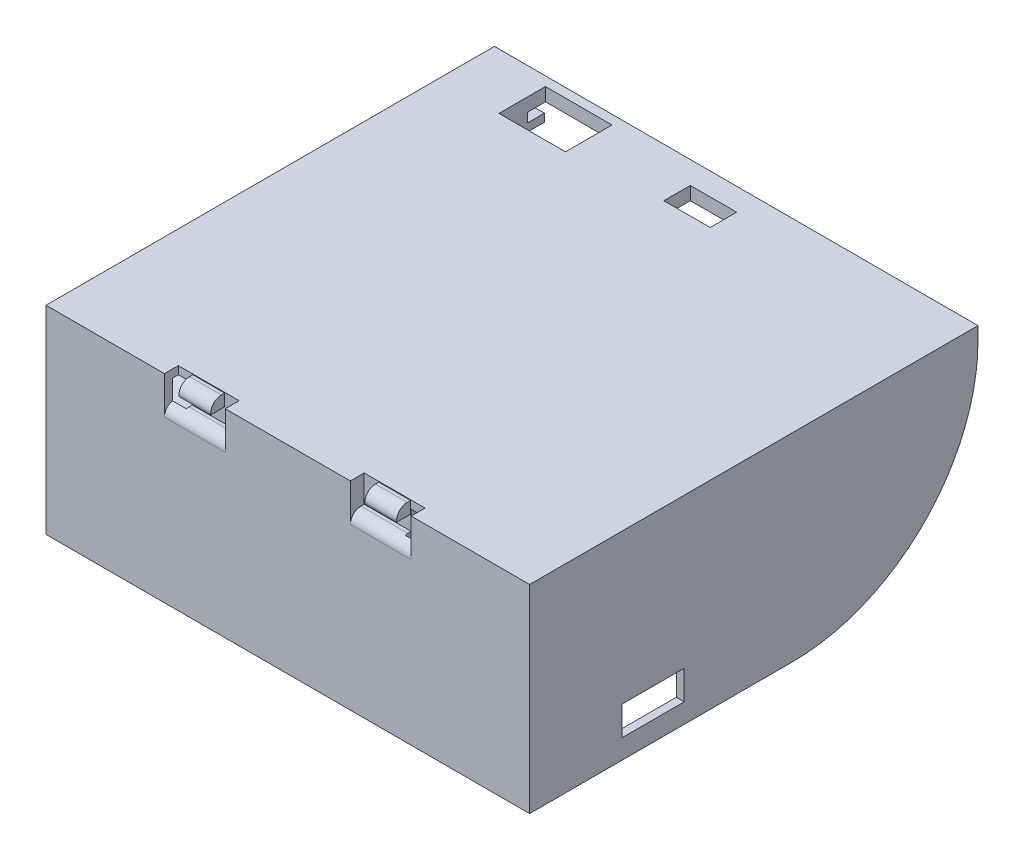
from build123d import *

# Parameters (mm, degrees)
SKETCH_3_W               = 73.1
SKETCH_3_H               = 20.7
EXTRUDE_2_DEPTH          = 13
SKETCH_4_W               = 73.1
SKETCH_4_H               = 20.7
EXTRUDE_3_DEPTH          = 1.2
EXTRUDE_START            = -4.2
SKETCH_2_R               = 9
EXTRUDE_1_DEPTH          = 65
EXTRUDE_START_2          = -20
EXTRUDE_4_DEPTH          = 5
EXTRUDE_5_REACH          = 80.453
SKETCH_6_W               = 11
SKETCH_6_H               = 5.55
EXTRUDE_START_3          = -73.1
SKETCH_6_2_W             = 11
SKETCH_6_2_H             = 5.55
EXTRUDE_6_DEPTH          = 2.7
PATTERN_LINEAR_1_COUNT   = 3
PATTERN_LINEAR_1_PITCH   = 19.5
SKETCH_7_W               = 73.1
SKETCH_7_H               = 8.075418161
EXTRUDE_7_DEPTH          = 2
MOVE_START               = -396.904341608
MOVE_FACE_1_DEPTH        = 23.1
EXTRUDE_9_DEPTH          = 1.2
EXTRUDE_START_4          = -71.9
EXTRUDE_10_DEPTH         = 1.2
SKETCH_11_W              = 70.7
SKETCH_11_H              = 1.2
EXTRUDE_11_DEPTH         = 15.8
OTHER_START              = -2.9
OTHER_1_DEPTH            = 2.2
OTHER_START_2            = -0.7
OTHER_1_2_OUTLINE_W      = 2.2
OTHER_1_2_OUTLINE_H      = 2.1
OTHER_1_2_DEPTH          = 1.9
OTHER_START_3            = 1.1
OTHER_1_3_OUTLINE_W      = 4.8
OTHER_1_3_OUTLINE_H      = 2.1
OTHER_1_3_DEPTH          = 0.1
FILLET_1_R               = 1.6
SKETCH_12_W              = 7
SKETCH_12_H              = 4
CUT_EXTRUDE_3_DEPTH      = 2
EXTRUDE_12_DEPTH         = 70.7
EXTRUDE_13_DEPTH         = 26.45
EXTRUDE_START_5          = -44.25
EXTRUDE_14_DEPTH         = 26.45
SKETCH_14_W              = 9.4
SKETCH_14_H              = 4.4
CUT_EXTRUDE_4_DEPTH      = 2
CUT_EXTRUDE_5_DEPTH      = 2
CUT_EXTRUDE_6_DEPTH      = 6
CUT_EXTRUDE_6_DEPTH_BACK = 426.308169417
SKETCH_16_W              = 10.06
SKETCH_16_H              = 7.03


# Read off the part's stored shape, not the designer's step: Переместить грань1, Отступ1
with BuildPart() as part:
    # Эскиз3 → Бобышка-Вытянуть2 (new body)
    with BuildSketch(Plane(origin=(0, 0, 0), x_dir=(1, 0, 0), z_dir=(0, 1, 0))):
        with Locations((-385.354341608, -11.602219826)):
            Rectangle(SKETCH_3_W, SKETCH_3_H)
        Polygon((-420.304341608, -2.452219826), (-350.404341608, -2.452219826), (-350.404341608, -4.102219826), (-351.504341608, -5.702219826), (-351.504341608, -7.302219826), (-350.904341608, -7.302219826), (-350.904341608, -6.302219826), (-350.404341608, -6.302219826), (-350.404341608, -16.902219826), (-350.904341608, -16.902219826), (-350.904341608, -15.902219826), (-351.504341608, -15.902219826), (-351.504341608, -17.502219826), (-350.404341608, -19.102219826), (-350.404341608, -20.752219826), (-420.304341608, -20.752219826), (-420.304341608, -19.102219826), (-419.204341608, -17.502219826), (-419.204341608, -15.902219826), (-419.804341608, -15.902219826), (-419.804341608, -16.902219826), (-420.304341608, -16.902219826), (-420.304341608, -6.302219826), (-419.804341608, -6.302219826), (-419.804341608, -7.302219826), (-419.204341608, -7.302219826), (-419.204341608, -5.702219826), (-420.304341608, -4.102219826), align=None, mode=Mode.SUBTRACT)
    extrude(amount=-EXTRUDE_2_DEPTH)

    # Эскиз4 → Бобышка-Вытянуть3 (add)
    with BuildSketch(Plane(origin=(0, 0, 0), x_dir=(1, 0, 0), z_dir=(0, 1, 0))):
        with Locations((-385.354341608, -11.602219826)):
            Rectangle(SKETCH_4_W, SKETCH_4_H)
    extrude(amount=EXTRUDE_3_DEPTH)

    # Эскиз5 → Бобышка-Вытянуть4 (add)
    with BuildSketch(Plane.ZY.offset(421.904341608).offset(EXTRUDE_START_2)):
        with BuildLine():
            Line((20.752219826, 0), (12.958685823, 0))
            ThreePointArc((12.958685823, 0), (18.142957552, -2.609262274), (20.752219826, -7.793534003))
            Line((20.752219826, -7.793534003), (20.752219826, 0))
        make_face()
        with BuildLine():
            Line((20.752219826, -13), (20.752219826, -10.506465997))
            ThreePointArc((20.752219826, -10.506465997), (20.566263185, -11.432197772), (20.286901427, -12.334149102))
            Line((20.286901427, -12.334149102), (20.752219826, -13))
        make_face()
        with BuildLine():
            Line((2.452219826, 0), (10.24575383, 0))
            ThreePointArc((10.24575383, 0), (5.0614821, -2.609262274), (2.452219826, -7.793534003))
            Line((2.452219826, -7.793534003), (2.452219826, 0))
        make_face()
        with BuildLine():
            Line((2.452219826, -13), (2.917538226, -12.334149102))
            ThreePointArc((2.917538226, -12.334149102), (2.638176468, -11.432197772), (2.452219826, -10.506465997))
            Line((2.452219826, -10.506465997), (2.452219826, -13))
        make_face()
    extrude_4 = extrude(amount=-EXTRUDE_4_DEPTH)

    # Зеркальное отражение1: Бобышка-Вытянуть4 across plane
    add(extrude_4.mirror(Plane.ZY.offset(385.354341608)))

    # Бобышка-Вытянуть5: up to this face of the body (flat: up to its plane)
    extrude_5_end = Plane(part.part.faces().sort_by_distance((-419.204341608, -6.5, 6.502219826))[0])
    # Эскиз6 → Бобышка-Вытянуть5 (add, up to the picked face)
    with BuildSketch(Plane.ZY.offset(421.904341608), mode=Mode.PRIVATE) as extrude_5_sk1:
        with Locations((11.602219826, -1.575)):
            Rectangle(SKETCH_6_W, SKETCH_6_H)
    extrude_5_tool1 = split(extrude(extrude_5_sk1.sketch, amount=-EXTRUDE_5_REACH, mode=Mode.PRIVATE), bisect_by=extrude_5_end, keep=Keep.BOTH, mode=Mode.PRIVATE)
    add(extrude_5_tool1.solids().sort_by(Axis((-421.904342, -1.575, 11.60222), (1, 0, 0)))[0])

    # Эскиз6<2> → Бобышка-Вытянуть6 (add)
    with BuildSketch(Plane.ZY.offset(421.904341608).offset(EXTRUDE_START_3)):
        with Locations((11.602219826, -1.575)):
            Rectangle(SKETCH_6_2_W, SKETCH_6_2_H)
    extrude(amount=EXTRUDE_6_DEPTH)


with BuildPart() as body_2:
    # Эскиз2 → Бобышка-Вытянуть1 (new body)
    with BuildSketch(Plane(origin=(-421.904341608, 0.36418433, 0), x_dir=(0, 0, 1), z_dir=(-1, 0, 0)).offset(EXTRUDE_START)):
        with Locations(Location((11.602219826, -9.51418433, 0), (0, 0, 270))):
            Circle(SKETCH_2_R)
    extrude(amount=-EXTRUDE_1_DEPTH)


with BuildPart() as pattern_linear_1_1:
    # Линейный массив1: pattern copy
    add(body_2.part.moved(Location(Vector(0, 0, -1) * (1 * PATTERN_LINEAR_1_PITCH))))


with BuildPart() as pattern_linear_1_2:
    # Линейный массив1: pattern copy
    add(body_2.part.moved(Location(Vector(0, 0, -1) * (2 * PATTERN_LINEAR_1_PITCH))))


with BuildPart() as pattern_linear_1_3:
    # Линейный массив1: pattern copy
    add(part.part.moved(Location(Vector(0, 0, -1) * (1 * PATTERN_LINEAR_1_PITCH))))


with BuildPart() as pattern_linear_1_4:
    # Линейный массив1: pattern copy
    add(part.part.moved(Location(Vector(0, 0, -1) * (2 * PATTERN_LINEAR_1_PITCH))))


with BuildPart() as part_1:
    add(part.part)

    # Combine 1: union Линейный массив1_3, Линейный массив1_4
    add(pattern_linear_1_3.part)
    add(pattern_linear_1_4.part)

    # Эскиз7 → Бобышка-Вытянуть7 (add)
    with BuildSketch(Plane(origin=(0, 1.2, 0), x_dir=(1, 0, 0), z_dir=(0, 1, 0))):
        with Locations((-385.354341608, 41.785489254)):
            Rectangle(SKETCH_7_W, SKETCH_7_H)
    extrude(amount=-EXTRUDE_7_DEPTH)

    # Move Face 1 outline → Move Face 1 (add)
    with BuildSketch(Plane.YZ.offset(MOVE_START)):
        with BuildLine():
            Line((0, 20.752219826), (-7.793534003, 20.752219826))
            ThreePointArc((-7.793534003, 20.752219826), (-2.609262274, 18.142957552), (0, 12.958685823))
            Line((0, 12.958685823), (0, 20.752219826))
        make_face()
        with BuildLine():
            ThreePointArc((0, -28.75424617), (-2.609262274, -33.9385179), (-7.793534003, -36.547780174))
            Line((-7.793534003, -36.547780174), (0, -36.547780174))
            Line((0, -36.547780174), (0, -28.75424617))
        make_face()
    extrude(amount=MOVE_FACE_1_DEPTH)

    # Эскиз10 → Бобышка-Вытянуть9 (add)
    with BuildSketch(Plane.ZY.offset(421.904341608)):
        with BuildLine():
            Line((21.952219826, 1.2), (21.952219826, -28.8))
            Line((21.952219826, -28.8), (-17.823198335, -28.8))
            ThreePointArc((-17.823198335, -28.8), (-37.622188208, -20.598989873), (-45.823198335, -0.8))
            Line((-45.823198335, -0.8), (-45.823198335, 1.2))
            Line((-45.823198335, 1.2), (21.952219826, 1.2))
        make_face()
    extrude(amount=-EXTRUDE_9_DEPTH)

    # Эскиз10<2> → Бобышка-Вытянуть10 (add)
    with BuildSketch(Plane.ZY.offset(421.904341608).offset(EXTRUDE_START_4)):
        Polygon((21.952219826, -13), (21.952219826, 1.2), (-45.823198335, 1.2), (-45.823198335, -0.8), (-37.747780174, -0.8), (-37.747780174, -13), align=None)
        with BuildLine():
            Line((21.952219826, -28.8), (21.952219826, -13))
            Line((21.952219826, -13), (-37.747780174, -13))
            Line((-37.747780174, -13), (-37.747780174, -0.8))
            Line((-37.747780174, -0.8), (-45.823198335, -0.8))
            ThreePointArc((-45.823198335, -0.8), (-37.622188208, -20.598989873), (-17.823198335, -28.8))
            Line((-17.823198335, -28.8), (21.952219826, -28.8))
        make_face()
    extrude(amount=-EXTRUDE_10_DEPTH)

    # Эскиз11 → Бобышка-Вытянуть11 (add)
    with BuildSketch(Plane(origin=(0, -13, 0), x_dir=(-1, 0, 0), z_dir=(0, -1, 0))):
        with Locations((385.354341608, -21.352219826)):
            Rectangle(SKETCH_11_W, SKETCH_11_H)
    extrude(amount=EXTRUDE_11_DEPTH)

    # Other 1 outline → Other 1 (cut)
    with BuildSketch(Plane(origin=(0, 0, 0), x_dir=(1, 0, 0), z_dir=(0, 1, 0)).offset(OTHER_START)):
        Polygon((-366.704341608, -21.952219826), (-366.704341608, -19.852219826), (-368.804341608, -19.852219826), (-375.904341608, -19.852219826), (-375.904341608, -21.952219826), align=None)
        Polygon((-394.804341608, -21.952219826), (-394.804341608, -19.852219826), (-401.904341608, -19.852219826), (-404.004341608, -19.852219826), (-404.004341608, -21.952219826), align=None)
    extrude(amount=OTHER_1_DEPTH, mode=Mode.SUBTRACT)

    # Other 1 2 outline → Other 1 2 (cut)
    with BuildSketch(Plane(origin=(0, 0, 0), x_dir=(1, 0, 0), z_dir=(0, 1, 0)).offset(OTHER_START_2)):
        with Locations((-395.904341608, -20.902219826)):
            Rectangle(OTHER_1_2_OUTLINE_W, OTHER_1_2_OUTLINE_H)
        Polygon((-368.804341608, -19.852219826), (-368.904341608, -19.852219826), (-368.904341608, -21.952219826), (-366.704341608, -21.952219826), (-366.704341608, -19.852219826), align=None)
        with Locations((-374.804341608, -20.902219826)):
            Rectangle(OTHER_1_2_OUTLINE_W, OTHER_1_2_OUTLINE_H)
        Polygon((-404.004341608, -21.952219826), (-401.804341608, -21.952219826), (-401.804341608, -19.852219826), (-401.904341608, -19.852219826), (-404.004341608, -19.852219826), align=None)
    extrude(amount=OTHER_1_2_DEPTH, mode=Mode.SUBTRACT)

    # Other 1 3 outline → Other 1 3 (cut)
    with BuildSketch(Plane(origin=(0, 0, 0), x_dir=(1, 0, 0), z_dir=(0, 1, 0)).offset(OTHER_START_3)):
        with Locations((-371.304341608, -20.902219826)):
            Rectangle(OTHER_1_3_OUTLINE_W, OTHER_1_3_OUTLINE_H)
        with Locations((-399.404341608, -20.902219826)):
            Rectangle(OTHER_1_3_OUTLINE_W, OTHER_1_3_OUTLINE_H)
    extrude(amount=OTHER_1_3_DEPTH, mode=Mode.SUBTRACT)

    # Скругление1
    # the kernel refuses this fillet: 1.6 mm, written as the material it takes off along each edge
    with BuildSketch(Plane(origin=(-405.804341608, 1.1, 21.952219826), x_dir=(0, 0, -1), z_dir=(1, 0, 0))) as fillet_1_piece_1_section:
        with BuildLine():
            CenterArc((FILLET_1_R, -FILLET_1_R), FILLET_1_R, 90, 90)
            Line((0, -FILLET_1_R), (0, 0))
            Line((0, 0), (FILLET_1_R, 0))
        make_face()
    fillet_1_piece_1 = extrude(amount=8.8, mode=Mode.PRIVATE)
    fillet_1_piece_1 = split(fillet_1_piece_1, bisect_by=Plane(origin=(-404.004341608, 0.742611298, 21.594831124), z_dir=(1, 0, 0)), keep=Keep.TOP, mode=Mode.PRIVATE)
    add(fillet_1_piece_1, mode=Mode.SUBTRACT)
    with BuildSketch(Plane(origin=(-377.704341608, 1.1, 21.952219826), x_dir=(0, 0, -1), z_dir=(1, 0, 0))) as fillet_1_piece_2_section:
        with BuildLine():
            CenterArc((FILLET_1_R, -FILLET_1_R), FILLET_1_R, 90, 90)
            Line((0, -FILLET_1_R), (0, 0))
            Line((0, 0), (FILLET_1_R, 0))
        make_face()
    fillet_1_piece_2 = extrude(amount=8.8, mode=Mode.PRIVATE)
    fillet_1_piece_2 = split(fillet_1_piece_2, bisect_by=Plane(origin=(-375.904341608, 0.742611298, 21.594831124), z_dir=(1, 0, 0)), keep=Keep.TOP, mode=Mode.PRIVATE)
    add(fillet_1_piece_2, mode=Mode.SUBTRACT)
    with BuildSketch(Plane(origin=(-404.004341608, -2.9, 21.952219826), x_dir=(0, 0, -1), z_dir=(1, 0, 0)), Plane(origin=(-375.904341608, -2.9, 21.952219826), x_dir=(0, 0, -1), z_dir=(1, 0, 0))) as fillet_1_piece_3:
        with BuildLine():
            CenterArc((FILLET_1_R, -FILLET_1_R), FILLET_1_R, 90, 90)
            Line((-FILLET_1_R * 2.8674645991e-10, -FILLET_1_R), (0, 0))
            Line((0, 0), (FILLET_1_R, 0))
        make_face()
    extrude(amount=9.2, mode=Mode.SUBTRACT)

    # Эскиз12 → Вырез-Вытянуть3 (cut)
    with BuildSketch(Plane.XZ.offset(0.8)):
        with Locations((-385.390488384, -40.423198335)):
            Rectangle(SKETCH_12_W, SKETCH_12_H)
    extrude(amount=-CUT_EXTRUDE_3_DEPTH, mode=Mode.SUBTRACT)

    # Эскиз13 → Бобышка-Вытянуть12 (add)
    with BuildSketch(Plane(origin=(-350.004341608, 0, -350.004341608), x_dir=(0, 0, -1), z_dir=(1, 0, 0))):
        Polygon((-369.356561434, -27.5), (-368.156561434, -27.5), (-368.156561434, -23.67182403), (-370.756561434, -20.485585275), (-370.756561434, -24.7), (-369.356561434, -24.7), align=None)
    extrude(amount=-EXTRUDE_12_DEPTH)

    # Эскиз13<3> → Бобышка-Вытянуть13 (add)
    with BuildSketch(Plane(origin=(-350.004341608, 0, -350.004341608), x_dir=(0, 0, -1), z_dir=(1, 0, 0))):
        Polygon((-308.281321845, -0.8), (-310.581321845, -0.8), (-309.212707614, -3.4), (-305.74020684, -3.4), (-305.74020684, -2.2), (-308.281321845, -2.2), align=None)
        Polygon((-368.156561434, -27.5), (-368.156561434, -23.67182403), (-370.756561434, -20.485585275), (-370.756561434, -24.7), (-369.356561434, -24.7), (-369.356561434, -27.5), align=None)
    extrude(amount=-EXTRUDE_13_DEPTH)

    # Эскиз13<4> → Бобышка-Вытянуть14 (add)
    with BuildSketch(Plane(origin=(-350.004341608, 0, -350.004341608), x_dir=(0, 0, -1), z_dir=(1, 0, 0)).offset(EXTRUDE_START_5)):
        Polygon((-308.281321845, -0.8), (-310.581321845, -0.8), (-309.212707614, -3.4), (-305.74020684, -3.4), (-305.74020684, -2.2), (-308.281321845, -2.2), align=None)
        Polygon((-368.156561434, -27.5), (-368.156561434, -23.67182403), (-370.756561434, -20.485585275), (-370.756561434, -24.7), (-369.356561434, -24.7), (-369.356561434, -27.5), align=None)
    extrude(amount=-EXTRUDE_14_DEPTH)

    # Эскиз14 → Вырез-Вытянуть4 (cut)
    with BuildSketch(Plane(origin=(-348.804341608, 0, 0), x_dir=(0, 0, -1), z_dir=(1, 0, 0))):
        with Locations((-3.280116687, -23.65)):
            Rectangle(SKETCH_14_W, SKETCH_14_H)
    extrude(amount=-CUT_EXTRUDE_4_DEPTH, mode=Mode.SUBTRACT)

    # Эскиз15 → Вырез-Вытянуть5 (cut)
    with BuildSketch(Plane.ZY.offset(421.904341608)):
        with BuildLine():
            Line((-5.843158387, -24.541421356), (-5.843158387, -23.9))
            ThreePointArc((-5.843158387, -23.9), (-6.077472962, -23.334314575), (-6.643158387, -23.1))
            Line((-6.643158387, -23.1), (-12.893158387, -23.1))
            ThreePointArc((-12.893158387, -23.1), (-13.458843812, -23.334314575), (-13.693158387, -23.9))
            Line((-13.693158387, -23.9), (-13.693158387, -24.541421356))
            Line((-13.693158387, -24.541421356), (-12.334579744, -25.9))
            Line((-12.334579744, -25.9), (-7.201737031, -25.9))
            Line((-7.201737031, -25.9), (-5.843158387, -24.541421356))
        make_face()
        with BuildLine():
            Line((1.584396076, -26.25), (15.184396076, -26.25))
            ThreePointArc((15.184396076, -26.25), (15.537949466, -26.103553391), (15.684396076, -25.75))
            Line((15.684396076, -25.75), (15.684396076, -19.5))
            ThreePointArc((15.684396076, -19.5), (15.537949466, -19.146446609), (15.184396076, -19))
            Line((15.184396076, -19), (1.584396076, -19))
            ThreePointArc((1.584396076, -19), (1.230842685, -19.146446609), (1.084396076, -19.5))
            Line((1.084396076, -19.5), (1.084396076, -25.75))
            ThreePointArc((1.084396076, -25.75), (1.230842685, -26.103553391), (1.584396076, -26.25))
        make_face()
    extrude(amount=-CUT_EXTRUDE_5_DEPTH, mode=Mode.SUBTRACT)

    # Эскиз16 → Вырез-Вытянуть6 (cut, two sides: drawn at the far end of the back side and taken through both)
    with BuildSketch(Plane.XZ.offset(0.8).offset(-CUT_EXTRUDE_6_DEPTH_BACK)):
        with Locations((-407.754341608, -40.908198335)):
            Rectangle(SKETCH_16_W, SKETCH_16_H)
    extrude(amount=CUT_EXTRUDE_6_DEPTH + CUT_EXTRUDE_6_DEPTH_BACK, mode=Mode.SUBTRACT)


solid = Compound([body_2.part, pattern_linear_1_1.part, pattern_linear_1_2.part, part_1.part])
